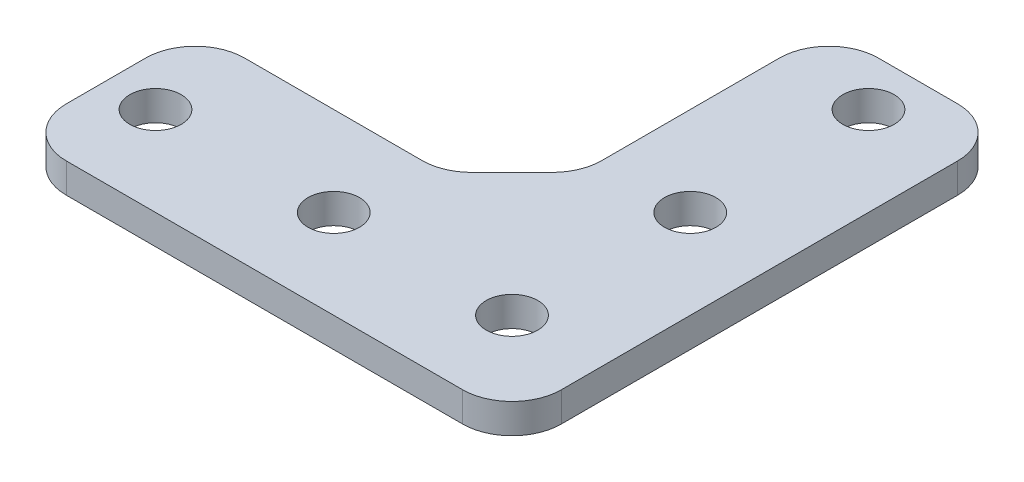
from build123d import *

# Parameters (mm, degrees)
SKETCH1_R          = 2.6
BASE_FLANGE1_DEPTH = 3
FILLET1_R          = 5
FILLET2_R          = 5


# Sheet-metal steps are written as plain solids
with BuildPart() as part:
    # Sketch1 → Base-Flange1 (new body)
    with BuildSketch(Plane(origin=(0, 0, 0), x_dir=(1, 0, 0), z_dir=(0, 1, 0))):
        Polygon((7, 25), (25, 25), (25, -25), (-25, -25), (-25, -7), (0, -7), (7, 0), align=None)
        with Locations(Location((16, -16, 0), (0, 0, 270))):
            Circle(SKETCH1_R, mode=Mode.SUBTRACT)
        with Locations(Location((-2, -16, 0), (0, 0, 270))):
            Circle(SKETCH1_R, mode=Mode.SUBTRACT)
        with Locations(Location((-20, -16, 0), (0, 0, 270))):
            Circle(SKETCH1_R, mode=Mode.SUBTRACT)
        with Locations(Location((16, 2, 0), (0, 0, 270))):
            Circle(SKETCH1_R, mode=Mode.SUBTRACT)
        with Locations(Location((16, 20, 0), (0, 0, 270))):
            Circle(SKETCH1_R, mode=Mode.SUBTRACT)
    extrude(amount=-BASE_FLANGE1_DEPTH)

    # Fillet1
    fillet1_edges = [part.edges().sort_by_distance(p)[0] for p in [
        (0, -1.5, 7),
        (7, -1.5, 0),
    ]]
    fillet(fillet1_edges, radius=FILLET1_R)

    # Fillet2
    fillet2_edges = [part.edges().sort_by_distance(p)[0] for p in [
        (25, -1.5, 25),
        (-25, -1.5, 25),
        (-25, -1.5, 7),
        (7, -1.5, -25),
        (25, -1.5, -25),
    ]]
    fillet(fillet2_edges, radius=FILLET2_R)


solid = part.part
